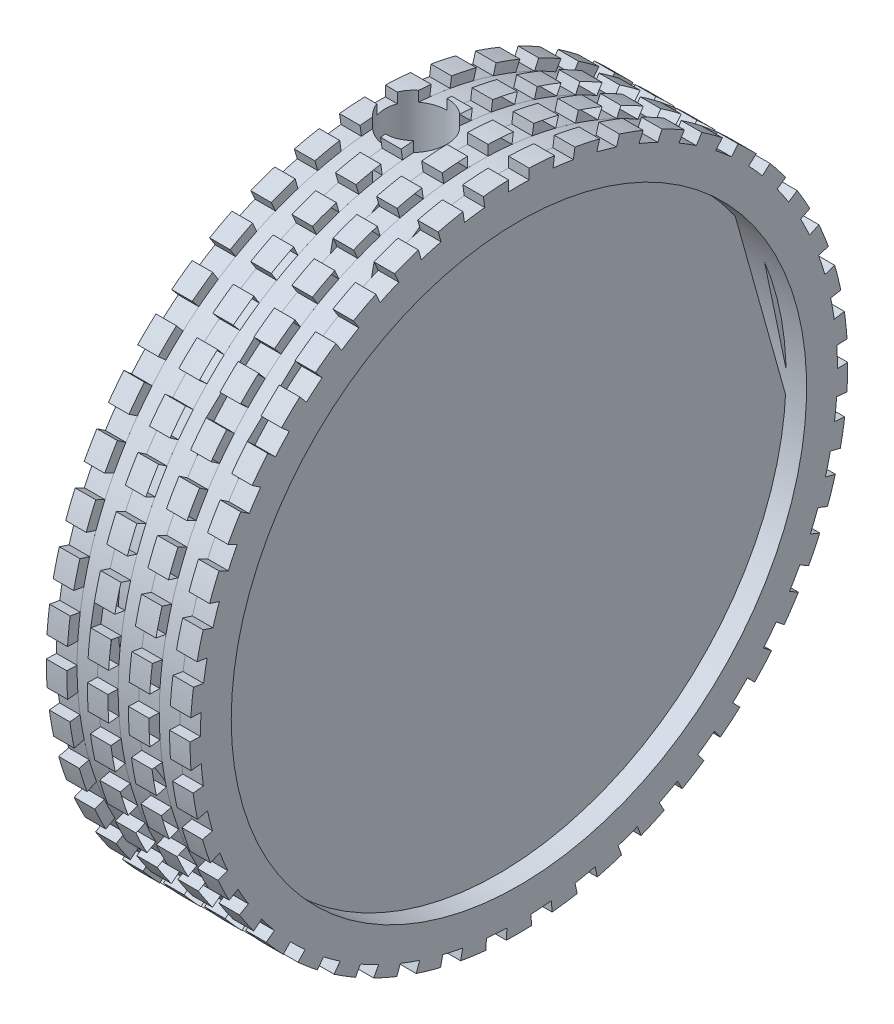
from build123d import *

# Parameters (mm, degrees)
SKETCH3_W                = 1
SKETCH3_H                = 0.5
CUT_EXTRUDE1_DEPTH       = 24.685438718
LPATTERN1_COUNT          = 3
LPATTERN1_PITCH          = 2
CIRPATTERN1_COUNT        = 45
CUT_EXTRUDE3_DEPTH       = 23.978250604
FILLET1_R                = 1
CIRPATTERN3_COUNT        = 3
CIRPATTERN3_ANGLE        = 232
FILLET1_OF_CIRPATTERN3_R = 1


with BuildPart() as part:
    # Sketch1 → Revolve1 (revolve)
    with BuildSketch(Plane.XY, mode=Mode.PRIVATE) as revolve1_sk:
        Polygon((7, 14), (7, 16), (0, 16), (0, 2), (5, 2), (5, 4), (4, 4), (4, 14), align=None)
    revolve(revolve1_sk.sketch.rotate(Axis((0, 0, 0), (1, 0, 0)), 90), axis=Axis((0, 0, 0), (1, 0, 0)))

    # Sketch2 → Cut-Revolve1 (revolve, cut)
    with BuildSketch(Plane.XY, mode=Mode.PRIVATE) as cut_revolve1_sk:
        Polygon((2, 0), (2, 16), (3.5, 16), (3.5, 11.5), (2.9, 11.5), (2.9, 0), align=None)
    revolve(cut_revolve1_sk.sketch.rotate(Axis((2, 0, 0), (0, 1, 0)), 90), axis=Axis((2, 0, 0), (0, 1, 0)), mode=Mode.SUBTRACT)

    # Sketch3 → Cut-Revolve2 (revolve, cut)
    with BuildSketch(Plane.XY, mode=Mode.PRIVATE) as cut_revolve2_sk:
        with Locations((5.5, 15.75)):
            Rectangle(SKETCH3_W, SKETCH3_H)
    cut_revolve2 = revolve(cut_revolve2_sk.sketch.rotate(Axis((0, 0, 0), (1, 0, 0)), 90), axis=Axis((0, 0, 0), (1, 0, 0)), mode=Mode.SUBTRACT)

    # Sketch4 → Cut-Extrude1 (cut, through all)
    with BuildSketch(Plane(origin=(0, 0, 0), x_dir=(0, 0, -1), z_dir=(1, 0, 0))):
        with BuildLine():
            Line((0.5, 15.492185592), (0.5, 15.992185592))
            ThreePointArc((0.5, 15.992185592), (0, 16), (-0.5, 15.992185592))
            Line((-0.5, 15.992185592), (-0.5, 15.492185592))
            ThreePointArc((-0.5, 15.492185592), (0, 15.500252076), (0.5, 15.492185592))
        make_face()
    cut_extrude1 = extrude(amount=CUT_EXTRUDE1_DEPTH, mode=Mode.SUBTRACT)

    # LPattern1: Cut-Revolve2 ×3
    with Locations(*[(-i * LPATTERN1_PITCH, 0, 0) for i in range(1, LPATTERN1_COUNT)]):
        add(cut_revolve2, mode=Mode.SUBTRACT)

    # CirPattern1: Cut-Extrude1 ×45 about axis
    cirpattern1_axis = Axis((0, 0, 0), (1, 0, 0))
    for i in range(1, CIRPATTERN1_COUNT):
        add(cut_extrude1.rotate(cirpattern1_axis, i * 360 / CIRPATTERN1_COUNT), mode=Mode.SUBTRACT)

    # Sketch5 → Cut-Extrude3 (cut, through all)
    with BuildSketch(Plane(origin=(4, 0, 0), x_dir=(0, 0, -1), z_dir=(1, 0, 0))):
        with BuildLine():
            Line((7.347315654, -10.11271243), (2.938926261, -4.045084972))
            ThreePointArc((2.938926261, -4.045084972), (-0.566016069, -4.967859278), (-3.773547901, -3.280295145))
            Line((-3.773547901, -3.280295145), (-9.433869753, -8.200737862))
            ThreePointArc((-9.433869753, -8.200737862), (-1.415040172, -12.419648196), (7.347315654, -10.11271243))
        make_face()
    cut_extrude3 = extrude(amount=-CUT_EXTRUDE3_DEPTH, mode=Mode.SUBTRACT)

    # Fillet1
    fillet1_edges = [part.edges().sort_by_distance(p)[0] for p in [
        (2, -10.11271243, -7.347315654),
        (2, -8.200737862, 9.433869753),
        (2, -3.280295145, 3.773547901),
        (2, -4.045084972, -2.938926261),
    ]]
    fillet(fillet1_edges, radius=FILLET1_R)

    # CirPattern3: Cut-Extrude3 ×3 about axis
    cirpattern3_axis = Axis((0, 0, 0), (-1, 0, 0))
    for i in range(1, CIRPATTERN3_COUNT):
        add(cut_extrude3.rotate(cirpattern3_axis, i * CIRPATTERN3_ANGLE / (CIRPATTERN3_COUNT - 1)), mode=Mode.SUBTRACT)

    # Fillet1 of CirPattern3
    fillet1_of_cirpattern3_edges = [part.edges().sort_by_distance(p)[0] for p in [
        (2, -2.170602221, 12.310096913),
        (2, 12.074072829, 3.235238064),
        (2, 4.829629131, 1.294095226),
        (2, -0.868240888, 4.924038765),
        (2, 12.015771199, -3.445466948),
        (2, -2.385112442, -12.270339793),
        (2, -0.954044977, -4.908135917),
        (2, 4.80630848, -1.378186779),
    ]]
    fillet(fillet1_of_cirpattern3_edges, radius=FILLET1_OF_CIRPATTERN3_R)


solid = part.part
